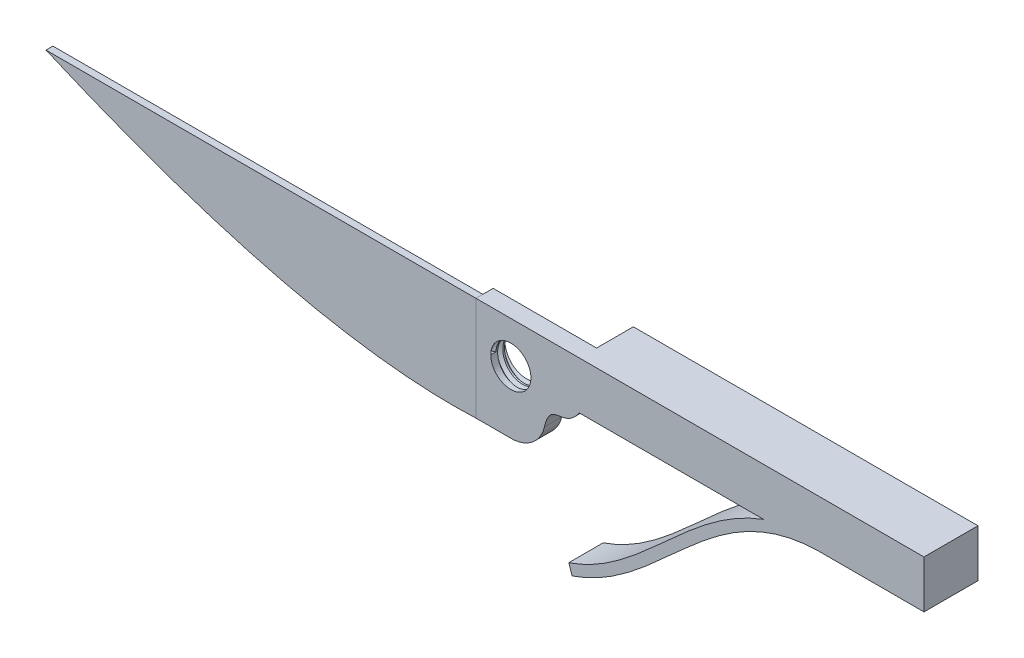
from build123d import *
from build123d.topology import SkipClean

# Parameters (mm, degrees)
SKETCH1_W           = 15.675969928
SKETCH1_H           = 13.81610909
BOSS_EXTRUDE1_DEPTH = 100
BOSS_EXTRUDE4_START = -5
BOSS_EXTRUDE4_DEPTH = 5
SKETCH5_R           = 5.827645208
CUT_EXTRUDE4_DEPTH  = 5
BOSS_EXTRUDE6_DEPTH = 2
THREAD1_PITCH       = 2
EXTRUDE_THIN1_START = -10
EXTRUDE_THIN1_DEPTH = 10


# Read off the part's stored shape, not the designer's step: Boss-Extrude4, Extrude-Thin1
with BuildPart() as part:
    # Sketch1 → Boss-Extrude1 (new body)
    with BuildSketch(Plane(origin=(0, 0, 0), x_dir=(0, 0, -1), z_dir=(1, 0, 0))):
        Rectangle(SKETCH1_W, SKETCH1_H)
    extrude(amount=-BOSS_EXTRUDE1_DEPTH)

    # Boss-Extrude4 outline → Boss-Extrude4 (add)
    with BuildSketch(Plane.XY.offset(7.837984964).offset(BOSS_EXTRUDE4_START)):
        with BuildLine():
            ThreePointArc((-119.86931436, -23.211198874), (-113.646481273, -21.039119951), (-110.126945105, -15.46646855))
            add(Edge.make_bspline(
                [(-110.126945105, -15.46646855), (-108.239108855, -7.311347217), (-104.677168821, -13.610922226), (-100, -6.908054545)],
                knots=[0, 0, 0, 0, 1, 1, 1, 1], degree=3))
            Line((-100, -6.908054545), (-100, 6.908054545))
            Line((-100, 6.908054545), (-130, 6.908054545))
            Line((-130, 6.908054545), (-130, -23.211198874))
            Line((-130, -23.211198874), (-119.86931436, -23.211198874))
        make_face()
    extrude(amount=BOSS_EXTRUDE4_DEPTH)

    # Sketch5 → Cut-Extrude4 (cut)
    with BuildSketch(Plane.XY.offset(7.837984964)):
        with Locations((-119.874886474, -5.129676039)):
            Circle(SKETCH5_R)
    extrude(amount=-CUT_EXTRUDE4_DEPTH, mode=Mode.SUBTRACT)

    # Thread1: the profile of Thread Profile1 profile screwed along a right-hand helix of 5 turns, 10 arcs to a turn; built about Z, then put on its axis
    with SkipClean():  # the faces are left unmerged after this step: merging them gives an invalid solid
        thread1_z = Axis((0, 0, 0), (0, 0, 1))
        thread1_corners = [(5.827345208, 0, -0.000173205), (6.910176958, 0, 0.624999997), (6.910176958, 0, 0.874999997), (5.827345208, 0, 1.5001732)]
        with BuildLine(mode=Mode.PRIVATE) as thread1_profile:
            Line(thread1_corners[0], thread1_corners[1])
            Line(thread1_corners[1], thread1_corners[2])
            Line(thread1_corners[2], thread1_corners[3])
            Line(thread1_corners[3], thread1_corners[0])
        thread1_cap = Face(thread1_profile.wire())
        thread1_turn_angles = [0, 18, 36, 54, 72, 90, 108, 126, 144, 162, 180, 198, 216, 234, 252, 270, 288, 306, 324, 342, 360]
        thread1_turn_weights = [1, 0.9510565162951535, 1, 0.9510565162951535, 1, 0.9510565162951535, 1, 0.9510565162951535, 1, 0.9510565162951535, 1, 0.9510565162951535, 1, 0.9510565162951535, 1, 0.9510565162951535, 1, 0.9510565162951535, 1, 0.9510565162951535, 1]
        thread1_turn_rails = [Edge.make_bspline([Vector(p[0], p[1], 0).rotate(thread1_z, thread1_turn_angles[k]) / thread1_turn_weights[k] + Vector(0, 0, p[2] + THREAD1_PITCH * thread1_turn_angles[k] / 360) for k in range(21)], [0, 0, 0, 1, 1, 2, 2, 3, 3, 4, 4, 5, 5, 6, 6, 7, 7, 8, 8, 9, 9, 10, 10, 10], 2, thread1_turn_weights) for p in thread1_corners]
        thread1_turn_sides = [Face.make_surface_from_curves(thread1_turn_rails[p[0]], thread1_turn_rails[p[1]]) for p in [(0, 1), (1, 2), (2, 3), (3, 0)]]
        thread1 = Plane(origin=(-119.874886474, -5.129676039, 7.837984964), x_dir=(-1, 0, 0), z_dir=(0, 0, -1)) * Solid(Shell([*[p.moved(Location((0, 0, THREAD1_PITCH * i))) for i in range(5) for p in thread1_turn_sides], thread1_cap, thread1_cap.rotate(thread1_z, 1800).moved(Location((0, 0, THREAD1_PITCH * 1800 / 360)))]))
        add(thread1, mode=Mode.SUBTRACT)

    # Extrude-Thin1 outline → Extrude-Thin1 (add)
    with SkipClean():  # the faces are left unmerged after this step: merging them gives an invalid solid
        with BuildSketch(Plane.XY.offset(7.837984964).offset(EXTRUDE_THIN1_START)):
            with BuildLine():
                Line((-30.516864105, -6.908054545), (-46.515971654, -6.908054538))
                add(Edge.make_bspline(
                    [(-46.515971654, -6.908054538), (-48.736955656, -7.734212416), (-50.860866994, -8.705576302), (-56.134252263, -11.506829556), (-59.157022601, -13.505328608), (-64.91951256, -17.814624525), (-67.660128751, -20.125796418), (-73.002872261, -24.834076188), (-75.605198651, -27.231459055), (-80.802689369, -31.896090341), (-83.397757294, -34.163164524), (-88.698277233, -38.359102075), (-91.403051044, -40.287501587), (-97.036608118, -43.616823713), (-99.963983255, -45.01825022), (-103.074569897, -46.073623226)],
                    knots=[0.171169667, 0.171169667, 0.171169667, 0.171169667, 0.25, 0.25, 0.375, 0.375, 0.5, 0.5, 0.625, 0.625, 0.75, 0.75, 0.875, 0.875, 1, 1, 1, 1], degree=3))
                Line((-103.074569897, -46.073623226), (-102.110684635, -48.914560606))
                add(Edge.make_bspline(
                    [(-30.516864105, -6.908054545), (-62.611800598, -7.475183496), (-75.440442664, -39.865767993), (-102.110684635, -48.914560606)],
                    knots=[0, 0, 0, 0, 1, 1, 1, 1], degree=3))
            make_face()
        extrude(amount=EXTRUDE_THIN1_DEPTH)


with BuildPart() as body_2:
    # Sketch7 → Boss-Extrude6 (new body)
    with BuildSketch(Plane.XY.offset(7.837984964)):
        with BuildLine():
            Line((-130, 6.908054545), (-254.753512548, 6.908054545))
            add(Edge.make_bspline(
                [(-254.753512548, 6.908054545), (-180.229624978, -25.383268756), (-130, -23.211198874)],
                knots=[0, 0, 0, 1, 1, 1], degree=2))
            Line((-130, -23.211198874), (-130, 6.908054545))
        make_face()
    extrude(amount=-BOSS_EXTRUDE6_DEPTH)


solid = Compound([part.part, body_2.part])
